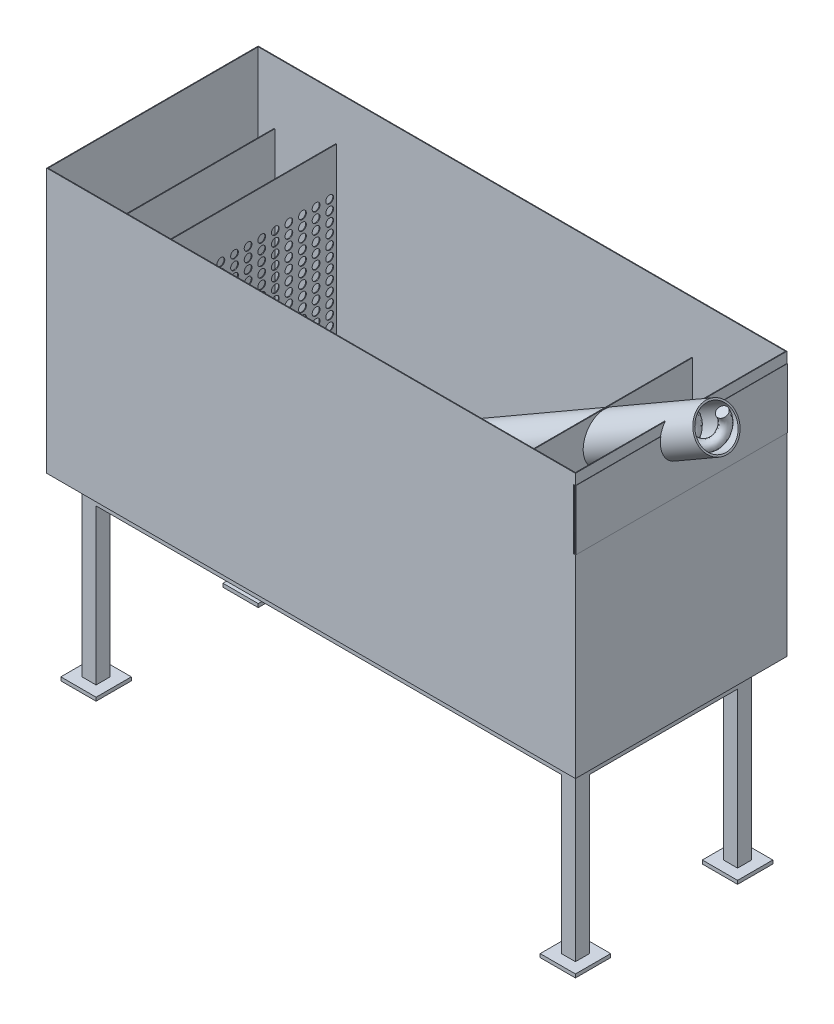
from build123d import *

# Parameters (mm, degrees)
MASTER_FOOTPRINT_W                       = 1500
MASTER_FOOTPRINT_H                       = 600
BATH_BASE_PLATE_DEPTH                    = 750
BATH_SHELL_2MM_T                         = -2
SKETCH_1_R                               = 50.00000000000001
INLET_D100_OPENING_DEPTH                 = 10
INLET_IMPACT_BAFFLE_START                = 125
SKETCH_2_W                               = 440
SKETCH_2_H                               = 430
INLET_IMPACT_BAFFLE_DEPTH                = 2
DISTRIBUTOR_D22_START                    = 250
SKETCH_3_W                               = 540
SKETCH_3_H                               = 648
SKETCH_3_R                               = 10.999999999999996
SKETCH_3_R_2                             = 11.00000000000001
SKETCH_3_R_3                             = 10.999999999999982
DISTRIBUTOR_D22_DEPTH                    = 2
OUTLET_SUBMERGED_BAFFLE_START            = 1280
SKETCH_4_W                               = 499.9999999999999
SKETCH_4_H                               = 330
OUTLET_SUBMERGED_BAFFLE_DEPTH            = 2
OVERFLOW_WEIR_Z550_START                 = 1440
SKETCH_5_W                               = 590
SKETCH_5_H                               = 548
OVERFLOW_WEIR_Z550_DEPTH                 = 2
OUTLET_WEIR_SLOT_W600_START              = 1495
SKETCH_6_W                               = 600
SKETCH_6_H                               = 170
OUTLET_WEIR_SLOT_W600_DEPTH              = 10
SLOPED_SEDIMENT_FLOOR_START              = 275
SLOPED_SEDIMENT_FLOOR_DEPTH              = 975
SKETCH_8_W                               = 39.99999999999999
SKETCH_8_H                               = 39.99999999999999
SKETCH_8_H_2                             = 39.99999999999994
SKETCH_8_W_2                             = 40
FRAME_LEGS_40X40_H500_DEPTH              = 500
FRAME_LONGITUDINAL_RAILS_START           = -20
SKETCH_9_W                               = 1400
SKETCH_9_H                               = 39.99999999999999
SKETCH_9_H_2                             = 39.99999999999983
FRAME_LONGITUDINAL_RAILS_DEPTH           = 40
FRAME_TRANSVERSE_RAILS_START             = -20
SKETCH_10_W                              = 39.99999999999999
SKETCH_10_H                              = 420.00000000000006
SKETCH_10_W_2                            = 40
FRAME_TRANSVERSE_RAILS_DEPTH             = 40
FRAME_FOOT_PADS_100X100_START            = -500
SKETCH_11_W                              = 100.00000000000001
SKETCH_11_H                              = 100.00000000000001
SKETCH_11_H_2                            = 99.99999999999994
SKETCH_11_W_2                            = 100
FRAME_FOOT_PADS_100X100_DEPTH            = 10
SCREW_PASSAGE_D120_PROFILE_R             = 60
SCREW_CASING_ID110_T5_PROFILE_R          = 60
SCREW_CASING_ID110_T5_PROFILE_R_2        = 55
SHAFTLESS_ROUND_COIL_D100_P100_PROFILE_R = 15
CFD_INLET_LID_D100_START                 = 1
SKETCH_12_R                              = 49.999999999999986
CFD_INLET_LID_D100_DEPTH                 = 2
CFD_OUTLET_LID_W600_START                = 1499
SKETCH_13_W                              = 600
SKETCH_13_H                              = 170
CFD_OUTLET_LID_W600_DEPTH                = 2


with BuildPart() as part:
    # MASTER_FOOTPRINT → BATH_BASE_PLATE (new body)
    with BuildSketch(Plane(origin=(0, 0, 0), x_dir=(1, 0, 0), z_dir=(0, 1, 0))):
        with Locations((750, 300)):
            Rectangle(MASTER_FOOTPRINT_W, MASTER_FOOTPRINT_H)
    extrude(amount=BATH_BASE_PLATE_DEPTH)

    # BATH_SHELL_2MM
    bath_shell_2mm_openings = [part.faces().sort_by_distance(p)[0] for p in [
        (750, 750, -300),
    ]]
    offset(amount=BATH_SHELL_2MM_T, openings=bath_shell_2mm_openings, kind=Kind.INTERSECTION)

    # Эскиз1 → INLET_D100_OPENING (cut)
    with BuildSketch(Plane(origin=(0, 0, 0), x_dir=(0, 0, -1), z_dir=(1, 0, 0))):
        with Locations((300, 420)):
            Circle(SKETCH_1_R)
    extrude(amount=INLET_D100_OPENING_DEPTH, mode=Mode.SUBTRACT)

    # Эскиз6 → OUTLET_WEIR_SLOT_W600 (cut)
    with BuildSketch(Plane(origin=(0, 0, 0), x_dir=(0, 0, -1), z_dir=(1, 0, 0)).offset(OUTLET_WEIR_SLOT_W600_START)):
        with Locations((300, 635)):
            Rectangle(SKETCH_6_W, SKETCH_6_H)
    extrude(amount=OUTLET_WEIR_SLOT_W600_DEPTH, mode=Mode.SUBTRACT)

    # Эскиз7 → SLOPED_SEDIMENT_FLOOR (add)
    with BuildSketch(Plane(origin=(0, 0, 0), x_dir=(0, 0, -1), z_dir=(1, 0, 0)).offset(SLOPED_SEDIMENT_FLOOR_START)):
        Polygon((2, -1), (2, 120), (229.99999999999997, -1), align=None)
        Polygon((598, -1), (598, 120), (370, -1), align=None)
    extrude(amount=SLOPED_SEDIMENT_FLOOR_DEPTH)

    # Эскиз8 → FRAME_LEGS_40X40_H500 (add)
    with BuildSketch(Plane(origin=(0, 0, 0), x_dir=(1, 0, 0), z_dir=(0, 1, 0))):
        with Locations((70, 70)):
            Rectangle(SKETCH_8_W, SKETCH_8_H)
        with Locations((70, 530)):
            Rectangle(SKETCH_8_W, SKETCH_8_H_2)
        with Locations((1430, 70)):
            Rectangle(SKETCH_8_W_2, SKETCH_8_H)
        with Locations((1430, 530)):
            Rectangle(SKETCH_8_W_2, SKETCH_8_H_2)
    extrude(amount=-FRAME_LEGS_40X40_H500_DEPTH)

    # Эскиз9 → FRAME_LONGITUDINAL_RAILS (add)
    with BuildSketch(Plane(origin=(0, 0, 0), x_dir=(1, 0, 0), z_dir=(0, 1, 0)).offset(FRAME_LONGITUDINAL_RAILS_START)):
        with Locations((750, 70)):
            Rectangle(SKETCH_9_W, SKETCH_9_H)
        with Locations((750, 530)):
            Rectangle(SKETCH_9_W, SKETCH_9_H_2)
    extrude(amount=-FRAME_LONGITUDINAL_RAILS_DEPTH)

    # Эскиз10 → FRAME_TRANSVERSE_RAILS (add)
    with BuildSketch(Plane(origin=(0, 0, 0), x_dir=(1, 0, 0), z_dir=(0, 1, 0)).offset(FRAME_TRANSVERSE_RAILS_START)):
        with Locations((70, 300)):
            Rectangle(SKETCH_10_W, SKETCH_10_H)
        with Locations((1430, 300)):
            Rectangle(SKETCH_10_W_2, SKETCH_10_H)
    extrude(amount=-FRAME_TRANSVERSE_RAILS_DEPTH)

    # Эскиз11 → FRAME_FOOT_PADS_100X100 (add)
    with BuildSketch(Plane(origin=(0, 0, 0), x_dir=(1, 0, 0), z_dir=(0, 1, 0)).offset(FRAME_FOOT_PADS_100X100_START)):
        with Locations((70, 70)):
            Rectangle(SKETCH_11_W, SKETCH_11_H)
        with Locations((70, 530)):
            Rectangle(SKETCH_11_W, SKETCH_11_H_2)
        with Locations((1430, 70)):
            Rectangle(SKETCH_11_W_2, SKETCH_11_H)
        with Locations((1430, 530)):
            Rectangle(SKETCH_11_W_2, SKETCH_11_H_2)
    extrude(amount=-FRAME_FOOT_PADS_100X100_DEPTH)


with BuildPart() as body_2:
    # Эскиз2 → INLET_IMPACT_BAFFLE (new body)
    with BuildSketch(Plane(origin=(0, 0, 0), x_dir=(0, 0, -1), z_dir=(1, 0, 0)).offset(INLET_IMPACT_BAFFLE_START)):
        with Locations((300, 435)):
            Rectangle(SKETCH_2_W, SKETCH_2_H)
    extrude(amount=INLET_IMPACT_BAFFLE_DEPTH)


with BuildPart() as body_3:
    # Эскиз3 → DISTRIBUTOR_D22 (new body)
    with BuildSketch(Plane(origin=(0, 0, 0), x_dir=(0, 0, -1), z_dir=(1, 0, 0)).offset(DISTRIBUTOR_D22_START)):
        with Locations((300, 326)):
            Rectangle(SKETCH_3_W, SKETCH_3_H)
        with Locations((49.28571428571428, 125)):
            Circle(SKETCH_3_R, mode=Mode.SUBTRACT)
        with Locations((49.28571428571428, 153.5)):
            Circle(SKETCH_3_R, mode=Mode.SUBTRACT)
        with Locations((49.28571428571428, 182)):
            Circle(SKETCH_3_R, mode=Mode.SUBTRACT)
        with Locations((49.28571428571428, 210.50000000000003)):
            Circle(SKETCH_3_R, mode=Mode.SUBTRACT)
        with Locations((49.28571428571428, 239)):
            Circle(SKETCH_3_R, mode=Mode.SUBTRACT)
        with Locations((49.28571428571428, 267.5)):
            Circle(SKETCH_3_R, mode=Mode.SUBTRACT)
        with Locations((49.28571428571428, 296.00000000000006)):
            Circle(SKETCH_3_R, mode=Mode.SUBTRACT)
        with Locations((49.28571428571428, 324.5)):
            Circle(SKETCH_3_R, mode=Mode.SUBTRACT)
        with Locations((49.28571428571428, 353)):
            Circle(SKETCH_3_R, mode=Mode.SUBTRACT)
        with Locations((49.28571428571428, 381.5)):
            Circle(SKETCH_3_R, mode=Mode.SUBTRACT)
        with Locations((49.28571428571428, 410.00000000000006)):
            Circle(SKETCH_3_R, mode=Mode.SUBTRACT)
        with Locations((49.28571428571428, 438.5)):
            Circle(SKETCH_3_R, mode=Mode.SUBTRACT)
        with Locations((49.28571428571428, 467)):
            Circle(SKETCH_3_R, mode=Mode.SUBTRACT)
        with Locations((49.28571428571428, 495.5)):
            Circle(SKETCH_3_R, mode=Mode.SUBTRACT)
        with Locations((49.28571428571428, 524)):
            Circle(SKETCH_3_R, mode=Mode.SUBTRACT)
        with Locations((87.85714285714285, 125)):
            Circle(SKETCH_3_R, mode=Mode.SUBTRACT)
        with Locations((87.85714285714285, 153.5)):
            Circle(SKETCH_3_R, mode=Mode.SUBTRACT)
        with Locations((87.85714285714285, 182)):
            Circle(SKETCH_3_R, mode=Mode.SUBTRACT)
        with Locations((87.85714285714285, 210.50000000000003)):
            Circle(SKETCH_3_R, mode=Mode.SUBTRACT)
        with Locations((87.85714285714285, 239)):
            Circle(SKETCH_3_R, mode=Mode.SUBTRACT)
        with Locations((87.85714285714285, 267.5)):
            Circle(SKETCH_3_R, mode=Mode.SUBTRACT)
        with Locations((87.85714285714285, 296.00000000000006)):
            Circle(SKETCH_3_R, mode=Mode.SUBTRACT)
        with Locations((87.85714285714285, 324.5)):
            Circle(SKETCH_3_R, mode=Mode.SUBTRACT)
        with Locations((87.85714285714285, 353)):
            Circle(SKETCH_3_R, mode=Mode.SUBTRACT)
        with Locations((87.85714285714285, 381.5)):
            Circle(SKETCH_3_R, mode=Mode.SUBTRACT)
        with Locations((87.85714285714285, 410.00000000000006)):
            Circle(SKETCH_3_R, mode=Mode.SUBTRACT)
        with Locations((87.85714285714285, 438.5)):
            Circle(SKETCH_3_R, mode=Mode.SUBTRACT)
        with Locations((87.85714285714285, 467)):
            Circle(SKETCH_3_R, mode=Mode.SUBTRACT)
        with Locations((87.85714285714285, 495.5)):
            Circle(SKETCH_3_R, mode=Mode.SUBTRACT)
        with Locations((87.85714285714285, 524)):
            Circle(SKETCH_3_R, mode=Mode.SUBTRACT)
        with Locations((126.42857142857142, 125)):
            Circle(SKETCH_3_R_2, mode=Mode.SUBTRACT)
        with Locations((126.42857142857142, 153.5)):
            Circle(SKETCH_3_R_2, mode=Mode.SUBTRACT)
        with Locations((126.42857142857142, 182)):
            Circle(SKETCH_3_R_2, mode=Mode.SUBTRACT)
        with Locations((126.42857142857142, 210.50000000000003)):
            Circle(SKETCH_3_R_2, mode=Mode.SUBTRACT)
        with Locations((126.42857142857142, 239)):
            Circle(SKETCH_3_R_2, mode=Mode.SUBTRACT)
        with Locations((126.42857142857142, 267.5)):
            Circle(SKETCH_3_R_2, mode=Mode.SUBTRACT)
        with Locations((126.42857142857142, 296.00000000000006)):
            Circle(SKETCH_3_R_2, mode=Mode.SUBTRACT)
        with Locations((126.42857142857142, 324.5)):
            Circle(SKETCH_3_R_2, mode=Mode.SUBTRACT)
        with Locations((126.42857142857142, 353)):
            Circle(SKETCH_3_R_2, mode=Mode.SUBTRACT)
        with Locations((126.42857142857142, 381.5)):
            Circle(SKETCH_3_R_2, mode=Mode.SUBTRACT)
        with Locations((126.42857142857142, 410.00000000000006)):
            Circle(SKETCH_3_R_2, mode=Mode.SUBTRACT)
        with Locations((126.42857142857142, 438.5)):
            Circle(SKETCH_3_R_2, mode=Mode.SUBTRACT)
        with Locations((126.42857142857142, 467)):
            Circle(SKETCH_3_R_2, mode=Mode.SUBTRACT)
        with Locations((126.42857142857142, 495.5)):
            Circle(SKETCH_3_R_2, mode=Mode.SUBTRACT)
        with Locations((126.42857142857142, 524)):
            Circle(SKETCH_3_R_2, mode=Mode.SUBTRACT)
        with Locations((164.99999999999997, 125)):
            Circle(SKETCH_3_R_2, mode=Mode.SUBTRACT)
        with Locations((164.99999999999997, 153.5)):
            Circle(SKETCH_3_R_2, mode=Mode.SUBTRACT)
        with Locations((164.99999999999997, 182)):
            Circle(SKETCH_3_R_2, mode=Mode.SUBTRACT)
        with Locations((164.99999999999997, 210.50000000000003)):
            Circle(SKETCH_3_R_2, mode=Mode.SUBTRACT)
        with Locations((164.99999999999997, 239)):
            Circle(SKETCH_3_R_2, mode=Mode.SUBTRACT)
        with Locations((164.99999999999997, 267.5)):
            Circle(SKETCH_3_R_2, mode=Mode.SUBTRACT)
        with Locations((164.99999999999997, 296.00000000000006)):
            Circle(SKETCH_3_R_2, mode=Mode.SUBTRACT)
        with Locations((164.99999999999997, 324.5)):
            Circle(SKETCH_3_R_2, mode=Mode.SUBTRACT)
        with Locations((164.99999999999997, 353)):
            Circle(SKETCH_3_R_2, mode=Mode.SUBTRACT)
        with Locations((164.99999999999997, 381.5)):
            Circle(SKETCH_3_R_2, mode=Mode.SUBTRACT)
        with Locations((164.99999999999997, 410.00000000000006)):
            Circle(SKETCH_3_R_2, mode=Mode.SUBTRACT)
        with Locations((164.99999999999997, 438.5)):
            Circle(SKETCH_3_R_2, mode=Mode.SUBTRACT)
        with Locations((164.99999999999997, 467)):
            Circle(SKETCH_3_R_2, mode=Mode.SUBTRACT)
        with Locations((164.99999999999997, 495.5)):
            Circle(SKETCH_3_R_2, mode=Mode.SUBTRACT)
        with Locations((164.99999999999997, 524)):
            Circle(SKETCH_3_R_2, mode=Mode.SUBTRACT)
        with Locations((203.57142857142856, 125)):
            Circle(SKETCH_3_R_2, mode=Mode.SUBTRACT)
        with Locations((203.57142857142856, 153.5)):
            Circle(SKETCH_3_R_2, mode=Mode.SUBTRACT)
        with Locations((203.57142857142856, 182)):
            Circle(SKETCH_3_R_2, mode=Mode.SUBTRACT)
        with Locations((203.57142857142856, 210.50000000000003)):
            Circle(SKETCH_3_R_2, mode=Mode.SUBTRACT)
        with Locations((203.57142857142856, 239)):
            Circle(SKETCH_3_R_2, mode=Mode.SUBTRACT)
        with Locations((203.57142857142856, 267.5)):
            Circle(SKETCH_3_R_2, mode=Mode.SUBTRACT)
        with Locations((203.57142857142856, 296.00000000000006)):
            Circle(SKETCH_3_R_2, mode=Mode.SUBTRACT)
        with Locations((203.57142857142856, 324.5)):
            Circle(SKETCH_3_R_2, mode=Mode.SUBTRACT)
        with Locations((203.57142857142856, 353)):
            Circle(SKETCH_3_R_2, mode=Mode.SUBTRACT)
        with Locations((203.57142857142856, 381.5)):
            Circle(SKETCH_3_R_2, mode=Mode.SUBTRACT)
        with Locations((203.57142857142856, 410.00000000000006)):
            Circle(SKETCH_3_R_2, mode=Mode.SUBTRACT)
        with Locations((203.57142857142856, 438.5)):
            Circle(SKETCH_3_R_2, mode=Mode.SUBTRACT)
        with Locations((203.57142857142856, 467)):
            Circle(SKETCH_3_R_2, mode=Mode.SUBTRACT)
        with Locations((203.57142857142856, 495.5)):
            Circle(SKETCH_3_R_2, mode=Mode.SUBTRACT)
        with Locations((203.57142857142856, 524)):
            Circle(SKETCH_3_R_2, mode=Mode.SUBTRACT)
        with Locations((242.14285714285714, 125)):
            Circle(SKETCH_3_R_3, mode=Mode.SUBTRACT)
        with Locations((242.14285714285714, 153.5)):
            Circle(SKETCH_3_R_3, mode=Mode.SUBTRACT)
        with Locations((242.14285714285714, 182)):
            Circle(SKETCH_3_R_3, mode=Mode.SUBTRACT)
        with Locations((242.14285714285714, 210.50000000000003)):
            Circle(SKETCH_3_R_3, mode=Mode.SUBTRACT)
        with Locations((242.14285714285714, 239)):
            Circle(SKETCH_3_R_3, mode=Mode.SUBTRACT)
        with Locations((242.14285714285714, 267.5)):
            Circle(SKETCH_3_R_3, mode=Mode.SUBTRACT)
        with Locations((242.14285714285714, 296.00000000000006)):
            Circle(SKETCH_3_R_3, mode=Mode.SUBTRACT)
        with Locations((242.14285714285714, 324.5)):
            Circle(SKETCH_3_R_3, mode=Mode.SUBTRACT)
        with Locations((242.14285714285714, 353)):
            Circle(SKETCH_3_R_3, mode=Mode.SUBTRACT)
        with Locations((242.14285714285714, 381.5)):
            Circle(SKETCH_3_R_3, mode=Mode.SUBTRACT)
        with Locations((242.14285714285714, 410.00000000000006)):
            Circle(SKETCH_3_R_3, mode=Mode.SUBTRACT)
        with Locations((242.14285714285714, 438.5)):
            Circle(SKETCH_3_R_3, mode=Mode.SUBTRACT)
        with Locations((242.14285714285714, 467)):
            Circle(SKETCH_3_R_3, mode=Mode.SUBTRACT)
        with Locations((242.14285714285714, 495.5)):
            Circle(SKETCH_3_R_3, mode=Mode.SUBTRACT)
        with Locations((242.14285714285714, 524)):
            Circle(SKETCH_3_R_3, mode=Mode.SUBTRACT)
        with Locations((280.71428571428567, 125)):
            Circle(SKETCH_3_R_2, mode=Mode.SUBTRACT)
        with Locations((280.71428571428567, 153.5)):
            Circle(SKETCH_3_R_2, mode=Mode.SUBTRACT)
        with Locations((280.71428571428567, 182)):
            Circle(SKETCH_3_R_2, mode=Mode.SUBTRACT)
        with Locations((280.71428571428567, 210.50000000000003)):
            Circle(SKETCH_3_R_2, mode=Mode.SUBTRACT)
        with Locations((280.71428571428567, 239)):
            Circle(SKETCH_3_R_2, mode=Mode.SUBTRACT)
        with Locations((280.71428571428567, 267.5)):
            Circle(SKETCH_3_R_2, mode=Mode.SUBTRACT)
        with Locations((280.71428571428567, 296.00000000000006)):
            Circle(SKETCH_3_R_2, mode=Mode.SUBTRACT)
        with Locations((280.71428571428567, 324.5)):
            Circle(SKETCH_3_R_2, mode=Mode.SUBTRACT)
        with Locations((280.71428571428567, 353)):
            Circle(SKETCH_3_R_2, mode=Mode.SUBTRACT)
        with Locations((280.71428571428567, 381.5)):
            Circle(SKETCH_3_R_2, mode=Mode.SUBTRACT)
        with Locations((280.71428571428567, 410.00000000000006)):
            Circle(SKETCH_3_R_2, mode=Mode.SUBTRACT)
        with Locations((280.71428571428567, 438.5)):
            Circle(SKETCH_3_R_2, mode=Mode.SUBTRACT)
        with Locations((280.71428571428567, 467)):
            Circle(SKETCH_3_R_2, mode=Mode.SUBTRACT)
        with Locations((280.71428571428567, 495.5)):
            Circle(SKETCH_3_R_2, mode=Mode.SUBTRACT)
        with Locations((280.71428571428567, 524)):
            Circle(SKETCH_3_R_2, mode=Mode.SUBTRACT)
        with Locations((319.2857142857143, 125)):
            Circle(SKETCH_3_R_2, mode=Mode.SUBTRACT)
        with Locations((319.2857142857143, 153.5)):
            Circle(SKETCH_3_R_2, mode=Mode.SUBTRACT)
        with Locations((319.2857142857143, 182)):
            Circle(SKETCH_3_R_2, mode=Mode.SUBTRACT)
        with Locations((319.2857142857143, 210.50000000000003)):
            Circle(SKETCH_3_R_2, mode=Mode.SUBTRACT)
        with Locations((319.2857142857143, 239)):
            Circle(SKETCH_3_R_2, mode=Mode.SUBTRACT)
        with Locations((319.2857142857143, 267.5)):
            Circle(SKETCH_3_R_2, mode=Mode.SUBTRACT)
        with Locations((319.2857142857143, 296.00000000000006)):
            Circle(SKETCH_3_R_2, mode=Mode.SUBTRACT)
        with Locations((319.2857142857143, 324.5)):
            Circle(SKETCH_3_R_2, mode=Mode.SUBTRACT)
        with Locations((319.2857142857143, 353)):
            Circle(SKETCH_3_R_2, mode=Mode.SUBTRACT)
        with Locations((319.2857142857143, 381.5)):
            Circle(SKETCH_3_R_2, mode=Mode.SUBTRACT)
        with Locations((319.2857142857143, 410.00000000000006)):
            Circle(SKETCH_3_R_2, mode=Mode.SUBTRACT)
        with Locations((319.2857142857143, 438.5)):
            Circle(SKETCH_3_R_2, mode=Mode.SUBTRACT)
        with Locations((319.2857142857143, 467)):
            Circle(SKETCH_3_R_2, mode=Mode.SUBTRACT)
        with Locations((319.2857142857143, 495.5)):
            Circle(SKETCH_3_R_2, mode=Mode.SUBTRACT)
        with Locations((319.2857142857143, 524)):
            Circle(SKETCH_3_R_2, mode=Mode.SUBTRACT)
        with Locations((357.8571428571428, 125)):
            Circle(SKETCH_3_R_2, mode=Mode.SUBTRACT)
        with Locations((357.8571428571428, 153.5)):
            Circle(SKETCH_3_R_2, mode=Mode.SUBTRACT)
        with Locations((357.8571428571428, 182)):
            Circle(SKETCH_3_R_2, mode=Mode.SUBTRACT)
        with Locations((357.8571428571428, 210.50000000000003)):
            Circle(SKETCH_3_R_2, mode=Mode.SUBTRACT)
        with Locations((357.8571428571428, 239)):
            Circle(SKETCH_3_R_2, mode=Mode.SUBTRACT)
        with Locations((357.8571428571428, 267.5)):
            Circle(SKETCH_3_R_2, mode=Mode.SUBTRACT)
        with Locations((357.8571428571428, 296.00000000000006)):
            Circle(SKETCH_3_R_2, mode=Mode.SUBTRACT)
        with Locations((357.8571428571428, 324.5)):
            Circle(SKETCH_3_R_2, mode=Mode.SUBTRACT)
        with Locations((357.8571428571428, 353)):
            Circle(SKETCH_3_R_2, mode=Mode.SUBTRACT)
        with Locations((357.8571428571428, 381.5)):
            Circle(SKETCH_3_R_2, mode=Mode.SUBTRACT)
        with Locations((357.8571428571428, 410.00000000000006)):
            Circle(SKETCH_3_R_2, mode=Mode.SUBTRACT)
        with Locations((357.8571428571428, 438.5)):
            Circle(SKETCH_3_R_2, mode=Mode.SUBTRACT)
        with Locations((357.8571428571428, 467)):
            Circle(SKETCH_3_R_2, mode=Mode.SUBTRACT)
        with Locations((357.8571428571428, 495.5)):
            Circle(SKETCH_3_R_2, mode=Mode.SUBTRACT)
        with Locations((357.8571428571428, 524)):
            Circle(SKETCH_3_R_2, mode=Mode.SUBTRACT)
        with Locations((396.42857142857133, 125)):
            Circle(SKETCH_3_R_2, mode=Mode.SUBTRACT)
        with Locations((396.42857142857133, 153.5)):
            Circle(SKETCH_3_R_2, mode=Mode.SUBTRACT)
        with Locations((396.42857142857133, 182)):
            Circle(SKETCH_3_R_2, mode=Mode.SUBTRACT)
        with Locations((396.42857142857133, 210.50000000000003)):
            Circle(SKETCH_3_R_2, mode=Mode.SUBTRACT)
        with Locations((396.42857142857133, 239)):
            Circle(SKETCH_3_R_2, mode=Mode.SUBTRACT)
        with Locations((396.42857142857133, 267.5)):
            Circle(SKETCH_3_R_2, mode=Mode.SUBTRACT)
        with Locations((396.42857142857133, 296.00000000000006)):
            Circle(SKETCH_3_R_2, mode=Mode.SUBTRACT)
        with Locations((396.42857142857133, 324.5)):
            Circle(SKETCH_3_R_2, mode=Mode.SUBTRACT)
        with Locations((396.42857142857133, 353)):
            Circle(SKETCH_3_R_2, mode=Mode.SUBTRACT)
        with Locations((396.42857142857133, 381.5)):
            Circle(SKETCH_3_R_2, mode=Mode.SUBTRACT)
        with Locations((396.42857142857133, 410.00000000000006)):
            Circle(SKETCH_3_R_2, mode=Mode.SUBTRACT)
        with Locations((396.42857142857133, 438.5)):
            Circle(SKETCH_3_R_2, mode=Mode.SUBTRACT)
        with Locations((396.42857142857133, 467)):
            Circle(SKETCH_3_R_2, mode=Mode.SUBTRACT)
        with Locations((396.42857142857133, 495.5)):
            Circle(SKETCH_3_R_2, mode=Mode.SUBTRACT)
        with Locations((396.42857142857133, 524)):
            Circle(SKETCH_3_R_2, mode=Mode.SUBTRACT)
        with Locations((434.99999999999994, 125)):
            Circle(SKETCH_3_R_2, mode=Mode.SUBTRACT)
        with Locations((434.99999999999994, 153.5)):
            Circle(SKETCH_3_R_2, mode=Mode.SUBTRACT)
        with Locations((434.99999999999994, 182)):
            Circle(SKETCH_3_R_2, mode=Mode.SUBTRACT)
        with Locations((434.99999999999994, 210.50000000000003)):
            Circle(SKETCH_3_R_2, mode=Mode.SUBTRACT)
        with Locations((434.99999999999994, 239)):
            Circle(SKETCH_3_R_2, mode=Mode.SUBTRACT)
        with Locations((434.99999999999994, 267.5)):
            Circle(SKETCH_3_R_2, mode=Mode.SUBTRACT)
        with Locations((434.99999999999994, 296.00000000000006)):
            Circle(SKETCH_3_R_2, mode=Mode.SUBTRACT)
        with Locations((434.99999999999994, 324.5)):
            Circle(SKETCH_3_R_2, mode=Mode.SUBTRACT)
        with Locations((434.99999999999994, 353)):
            Circle(SKETCH_3_R_2, mode=Mode.SUBTRACT)
        with Locations((434.99999999999994, 381.5)):
            Circle(SKETCH_3_R_2, mode=Mode.SUBTRACT)
        with Locations((434.99999999999994, 410.00000000000006)):
            Circle(SKETCH_3_R_2, mode=Mode.SUBTRACT)
        with Locations((434.99999999999994, 438.5)):
            Circle(SKETCH_3_R_2, mode=Mode.SUBTRACT)
        with Locations((434.99999999999994, 467)):
            Circle(SKETCH_3_R_2, mode=Mode.SUBTRACT)
        with Locations((434.99999999999994, 495.5)):
            Circle(SKETCH_3_R_2, mode=Mode.SUBTRACT)
        with Locations((434.99999999999994, 524)):
            Circle(SKETCH_3_R_2, mode=Mode.SUBTRACT)
        with Locations((473.57142857142856, 125)):
            Circle(SKETCH_3_R_2, mode=Mode.SUBTRACT)
        with Locations((473.57142857142856, 153.5)):
            Circle(SKETCH_3_R_2, mode=Mode.SUBTRACT)
        with Locations((473.57142857142856, 182)):
            Circle(SKETCH_3_R_2, mode=Mode.SUBTRACT)
        with Locations((473.57142857142856, 210.50000000000003)):
            Circle(SKETCH_3_R_2, mode=Mode.SUBTRACT)
        with Locations((473.57142857142856, 239)):
            Circle(SKETCH_3_R_2, mode=Mode.SUBTRACT)
        with Locations((473.57142857142856, 267.5)):
            Circle(SKETCH_3_R_2, mode=Mode.SUBTRACT)
        with Locations((473.57142857142856, 296.00000000000006)):
            Circle(SKETCH_3_R_2, mode=Mode.SUBTRACT)
        with Locations((473.57142857142856, 324.5)):
            Circle(SKETCH_3_R_2, mode=Mode.SUBTRACT)
        with Locations((473.57142857142856, 353)):
            Circle(SKETCH_3_R_2, mode=Mode.SUBTRACT)
        with Locations((473.57142857142856, 381.5)):
            Circle(SKETCH_3_R_2, mode=Mode.SUBTRACT)
        with Locations((473.57142857142856, 410.00000000000006)):
            Circle(SKETCH_3_R_2, mode=Mode.SUBTRACT)
        with Locations((473.57142857142856, 438.5)):
            Circle(SKETCH_3_R_2, mode=Mode.SUBTRACT)
        with Locations((473.57142857142856, 467)):
            Circle(SKETCH_3_R_2, mode=Mode.SUBTRACT)
        with Locations((473.57142857142856, 495.5)):
            Circle(SKETCH_3_R_2, mode=Mode.SUBTRACT)
        with Locations((473.57142857142856, 524)):
            Circle(SKETCH_3_R_2, mode=Mode.SUBTRACT)
        with Locations((512.1428571428571, 125)):
            Circle(SKETCH_3_R_2, mode=Mode.SUBTRACT)
        with Locations((512.1428571428571, 153.5)):
            Circle(SKETCH_3_R_2, mode=Mode.SUBTRACT)
        with Locations((512.1428571428571, 182)):
            Circle(SKETCH_3_R_2, mode=Mode.SUBTRACT)
        with Locations((512.1428571428571, 210.50000000000003)):
            Circle(SKETCH_3_R_2, mode=Mode.SUBTRACT)
        with Locations((512.1428571428571, 239)):
            Circle(SKETCH_3_R_2, mode=Mode.SUBTRACT)
        with Locations((512.1428571428571, 267.5)):
            Circle(SKETCH_3_R_2, mode=Mode.SUBTRACT)
        with Locations((512.1428571428571, 296.00000000000006)):
            Circle(SKETCH_3_R_2, mode=Mode.SUBTRACT)
        with Locations((512.1428571428571, 324.5)):
            Circle(SKETCH_3_R_2, mode=Mode.SUBTRACT)
        with Locations((512.1428571428571, 353)):
            Circle(SKETCH_3_R_2, mode=Mode.SUBTRACT)
        with Locations((512.1428571428571, 381.5)):
            Circle(SKETCH_3_R_2, mode=Mode.SUBTRACT)
        with Locations((512.1428571428571, 410.00000000000006)):
            Circle(SKETCH_3_R_2, mode=Mode.SUBTRACT)
        with Locations((512.1428571428571, 438.5)):
            Circle(SKETCH_3_R_2, mode=Mode.SUBTRACT)
        with Locations((512.1428571428571, 467)):
            Circle(SKETCH_3_R_2, mode=Mode.SUBTRACT)
        with Locations((512.1428571428571, 495.5)):
            Circle(SKETCH_3_R_2, mode=Mode.SUBTRACT)
        with Locations((512.1428571428571, 524)):
            Circle(SKETCH_3_R_2, mode=Mode.SUBTRACT)
        with Locations((550.7142857142857, 125)):
            Circle(SKETCH_3_R_2, mode=Mode.SUBTRACT)
        with Locations((550.7142857142857, 153.5)):
            Circle(SKETCH_3_R_2, mode=Mode.SUBTRACT)
        with Locations((550.7142857142857, 182)):
            Circle(SKETCH_3_R_2, mode=Mode.SUBTRACT)
        with Locations((550.7142857142857, 210.50000000000003)):
            Circle(SKETCH_3_R_2, mode=Mode.SUBTRACT)
        with Locations((550.7142857142857, 239)):
            Circle(SKETCH_3_R_2, mode=Mode.SUBTRACT)
        with Locations((550.7142857142857, 267.5)):
            Circle(SKETCH_3_R_2, mode=Mode.SUBTRACT)
        with Locations((550.7142857142857, 296.00000000000006)):
            Circle(SKETCH_3_R_2, mode=Mode.SUBTRACT)
        with Locations((550.7142857142857, 324.5)):
            Circle(SKETCH_3_R_2, mode=Mode.SUBTRACT)
        with Locations((550.7142857142857, 353)):
            Circle(SKETCH_3_R_2, mode=Mode.SUBTRACT)
        with Locations((550.7142857142857, 381.5)):
            Circle(SKETCH_3_R_2, mode=Mode.SUBTRACT)
        with Locations((550.7142857142857, 410.00000000000006)):
            Circle(SKETCH_3_R_2, mode=Mode.SUBTRACT)
        with Locations((550.7142857142857, 438.5)):
            Circle(SKETCH_3_R_2, mode=Mode.SUBTRACT)
        with Locations((550.7142857142857, 467)):
            Circle(SKETCH_3_R_2, mode=Mode.SUBTRACT)
        with Locations((550.7142857142857, 495.5)):
            Circle(SKETCH_3_R_2, mode=Mode.SUBTRACT)
        with Locations((550.7142857142857, 524)):
            Circle(SKETCH_3_R_2, mode=Mode.SUBTRACT)
    extrude(amount=DISTRIBUTOR_D22_DEPTH)


with BuildPart() as body_4:
    # Эскиз4 → OUTLET_SUBMERGED_BAFFLE (new body)
    with BuildSketch(Plane(origin=(0, 0, 0), x_dir=(0, 0, -1), z_dir=(1, 0, 0)).offset(OUTLET_SUBMERGED_BAFFLE_START)):
        with Locations((299.99999999999994, 485)):
            Rectangle(SKETCH_4_W, SKETCH_4_H)
    extrude(amount=OUTLET_SUBMERGED_BAFFLE_DEPTH)


with BuildPart() as body_5:
    # Эскиз5 → OVERFLOW_WEIR_Z550 (new body)
    with BuildSketch(Plane(origin=(0, 0, 0), x_dir=(0, 0, -1), z_dir=(1, 0, 0)).offset(OVERFLOW_WEIR_Z550_START)):
        with Locations((300, 276)):
            Rectangle(SKETCH_5_W, SKETCH_5_H)
    extrude(amount=OVERFLOW_WEIR_Z550_DEPTH)


with BuildPart() as screw_passage_d120_tool:
    # SCREW_PASSAGE_D120: sweep along a curve in space
    with BuildLine() as screw_passage_d120_path:
        Line((400, 70, -300), (1600, 762.820323027551, -300))
    # SCREW_PASSAGE_D120 profile (on start of the path) → SCREW_PASSAGE_D120 (sweep)
    with BuildSketch(Plane(origin=(400, 70, -300), x_dir=(-0.5000000000000001, 0.8660254037844387, 0), z_dir=(0.8660254037844387, 0.5000000000000001, 0))):
        Circle(SCREW_PASSAGE_D120_PROFILE_R)
    sweep(path=screw_passage_d120_path.line)


with BuildPart() as part_1:
    add(part.part)

    # SCREW_PASSAGE_D120: cut by screw_passage_d120_tool
    add(screw_passage_d120_tool.part, mode=Mode.SUBTRACT)


with BuildPart() as body_4_1:
    add(body_4.part)

    # SCREW_PASSAGE_D120: cut by screw_passage_d120_tool
    add(screw_passage_d120_tool.part, mode=Mode.SUBTRACT)


with BuildPart() as body_6:
    # SCREW_CASING_ID110_T5: sweep along a curve in space
    with BuildLine() as screw_casing_id110_t5_path:
        Line((400, 70, -300), (1600, 762.820323027551, -300))
    # SCREW_CASING_ID110_T5 profile (on start of the path) → SCREW_CASING_ID110_T5 (sweep)
    with BuildSketch(Plane(origin=(400, 70, -300), x_dir=(-0.5000000000000001, 0.8660254037844387, 0), z_dir=(0.8660254037844387, 0.5000000000000001, 0))):
        Circle(SCREW_CASING_ID110_T5_PROFILE_R)
        Circle(SCREW_CASING_ID110_T5_PROFILE_R_2, mode=Mode.SUBTRACT)
    sweep(path=screw_casing_id110_t5_path.line)


with BuildPart() as body_7:
    # SHAFTLESS_ROUND_COIL_D100_P100: sweep along a curve in space
    with BuildLine() as shaftless_round_coil_d100_p100_path:
        add(Edge.make_bspline(
            [(382.5, 100.31088913245537, -300), (384.564126832484, 100.89679960651334, -295.4252626190951), (388.6923804974521, 102.06862055462925, -286.2757878572854), (398.13442746402075, 98.19776454464007, -274.63543839458805), (409.3104600517273, 91.32355733924642, -266.8464038762299), (421.58617012040133, 82.54465286487766, -264.09135899256023), (433.85356596039986, 73.78014905700061, -266.78862540424325), (445.0881010529496, 66.80461254084834, -274.5286544424799), (454.4000360154246, 63.1591171326243, -286.13621233156675), (461.197456487716, 63.86888857776613, -299.8488258278908), (465.26866699277394, 69.30059419825714, -313.5843933715703), (466.8163390998659, 79.10319653887622, -325.25732809645314), (466.426200947709, 92.26218470394231, -333.09523004350996), (464.9782451375268, 107.25336679785208, -335.9080045692546), (463.5130734819898, 122.2743676106112, -333.2685644354147), (463.0739040042549, 135.5182805227412, -325.57767806015863), (464.54816759331237, 145.44803014630403, -314.003117474915), (468.5327626423438, 151.02975813735404, -300.302345664835), (475.2434227413281, 151.88980295714714, -286.55566616687736), (484.4819600829853, 148.37143595733454, -274.85035306876887), (495.6663579719135, 141.48273962520364, -266.96372261055393), (507.91914332354327, 132.7435419255055, -264.09326829583546), (520.2006207893836, 123.95464802621649, -266.6748353708781), (531.4667384557318, 116.92440888761196, -274.3164427712902), (540.8276150360007, 113.19414411076411, -285.85780090729605), (547.6826580387994, 113.80411040540636, -299.5464882011584), (551.8117567825574, 119.13555065530883, -313.30403600976126), (553.4087036535182, 128.85280660137536, -325.04152001826714), (553.0517689761136, 141.95428466118315, -332.9767392064443), (551.61589736088, 156.92453631547306, -335.9048224347294), (550.1398574976865, 171.9643614160809, -333.38117417370665), (549.6685171596843, 185.26399589271685, -325.7889811865904), (551.0941921320922, 195.27790346898624, -314.281030056743), (555.0211583937147, 200.95944744780704, -300.604669894888), (561.673899807404, 201.91981037323922, -286.83649761190105), (570.8630228451327, 198.48703145845056, -275.0670507260172), (582.0140138019443, 191.65619763007103, -267.08338345025123), (594.2544720488692, 182.9383511020314, -264.097723205211), (606.5465739655579, 174.13105511407133, -266.56340792353376), (617.8446544384698, 167.04545477054538, -274.1060519347144), (627.253978998992, 163.2312756303746, -285.58039209358253), (634.1665988909854, 163.7415158275906, -299.2441827261242), (638.3536610490263, 168.97256049897464, -313.0227354589283), (640.000156786148, 178.6039952913932, -324.82393662266566), (639.6768330052581, 191.64725757074916, -332.8559104849623), (638.2535308914903, 206.5957382098747, -335.89909482946143), (636.7671106014776, 221.65354273713788, -333.4914173551837), (636.2640160559722, 235.00817711452288, -325.99845600438135), (637.6413845488722, 245.10575396763522, -314.55793018559893), (641.510826838479, 250.88693238864008, -300.9069512568962), (648.1055611366372, 251.94776658537253, -287.11826228282376), (657.2450016240585, 248.6010403719662, -275.2855160035632), (668.3621783156997, 241.82877456888252, -267.20537791197194), (680.5898248871695, 233.1331185136615, -264.1047234048566), (692.8920630226701, 224.3082660797222, -266.45435096185395), (704.2216885412174, 217.16802811442864, -273.89749684840154), (713.6791772243276, 213.2704262668336, -285.3040055573114), (720.6492671516132, 213.6811254430106, -298.9419308347211), (724.8943790983257, 218.81162493104637, -312.7405116618611), (726.5906901893372, 228.356776999531, -324.60459333521385), (726.3013834429559, 241.34112004679574, -332.7327524452105), (724.8911349515606, 256.2669911487486, -335.8908221595088), (723.3948228303958, 271.3419288301475, -333.59928616416056), (722.860392960221, 284.75083758193153, -326.20608766282413), (724.1897405411053, 294.9315890944806, -314.8337982306609), (728.0017677507315, 300.8122133511328, -301.2091683206371), (734.538410615941, 301.9736648612168, -287.4009402039521), (743.6279038288086, 298.713449865037, -275.50573341332085), (754.7108613195153, 292.00045345656616, -267.3296973469242), (766.9252125530547, 283.32782560214406, -264.1142683984929), (779.2370979567269, 274.486263609578, -266.347672217427), (790.5978485235961, 267.29211547920306, -273.6907922978545), (800.1032140570355, 263.3115884943309, -285.0286608928936), (807.1306630913758, 263.6229387828122, -298.63975395508294), (811.4339070857119, 268.65275061081644, -312.457384626803), (813.1802964866847, 278.11116450209073, -324.3835057062438), (812.925410501169, 291.03588904270106, -332.6072738184727), (811.5286988276175, 305.9383136883758, -335.88000501136224), (810.0229841722486, 321.0295370367361, -333.70477295328305), (809.4576400817543, 334.4919907887895, -326.41186144188174), (810.7392557225559, 344.7554164467062, -315.1086146342763), (814.4939808146754, 350.7352908822605, -301.5112996604448), (820.9724520479086, 351.99749861448726, -287.6845113348483), (830.0117368029861, 348.8242472181694, -275.7276873429865), (841.0600725829635, 342.1712173717274, -267.4563329414875), (853.2606457586695, 333.5224538135015, -264.1263575094284), (865.5816887959296, 324.665030334284, -266.24337925323766), (876.9731422071981, 317.41770331747284, -273.48595293738316), (886.5260939244816, 313.3547546444449, -284.7543776208762), (893.6107870711676, 313.56695522190887, -298.3376735100261), (897.9722412508102, 318.49594405144467, -312.1733744260323), (899.768968367516, 327.86717046153177, -324.1606894097531), (899.5489044289652, 340.7315814475757, -332.4794835005502), (898.1662118090363, 355.6097243801021, -335.866644151903), (896.6515845830037, 370.7163847536779, -333.8078702440699), (896.0557495682019, 384.23165033580136, -326.6157627532315), (897.2899256248077, 394.5772437638356, -315.3823599133486), (900.9874656243259, 400.65616568521085, -301.8133238567323), (907.4076891506296, 402.01926140526336, -287.96895557174935), (916.396507824207, 398.93341982616283, -275.95136205714675), (927.409821838164, 392.34104945783844, -267.58527571783696), (939.5961352129292, 383.7169845993486, -264.1409898806059), (951.9258455999641, 374.8445488299541, -266.1414794631309), (963.347577475032, 367.54477797546673, -273.2829932890646), (972.9478213360536, 363.39991690668563, -284.4811751865597), (980.089639542058, 363.5131739790249, -298.0357109155295), (984.5093779178811, 368.3412116194976, -311.88850119443845), (986.3566985874025, 377.6248074255727, -323.9361602422928), (986.1718555132079, 390.428214085065, -332.3493905511316), (984.8036631888007, 405.2812417690236, -335.8507405283486), (983.2806139875005, 420.40248943166216, -333.9085707274435), (982.6547135060571, 433.96982992956356, -326.81777714129953), (983.8417456975797, 444.3970789271857, -315.6550146607195), (987.4822216835367, 450.57483861933343, -302.1152194975083), (993.844125557427, 452.0389469404455, -288.25425274899413), (1002.7822241035847, 449.0409551990032, -276.17674169839364), (1013.7601187790972, 442.5099329244342, -267.71651653458053), (1025.9316916207615, 433.9113994182065, -264.15816447466443), (1038.2695784592859, 425.0248016194053, -266.0419800712876), (1049.7211622709642, 417.6733256940053, -273.08192774171306), (1059.3684008828434, 413.44706732904916, -284.2090729586181), (1066.56722104526, 413.4615941167516, -297.7338875792175), (1071.0453134960828, 418.1885595344961, -311.60278512809674), (1072.9434799686742, 427.384087826303, -323.70993412184777), (1072.7942540792462, 440.12580371215705, -332.21700419315096), (1071.4410422642611, 454.95288439267284, -335.8322952681855), (1069.9100622801661, 470.087868574056, -334.0068672642477), (1069.254523921235, 483.70654338159477, -327.0178902842846), (1070.3947113090505, 494.21492995930737, -315.9265595465421), (1073.9782484060368, 500.49131070007934, -302.4169651798948), (1080.2817648165985, 502.0565490742017, -288.54038264045323), (1089.168892785218, 499.14684096274647, -276.4038102884464), (1100.1109730609141, 492.67785104830193, -267.8500460874069), (1112.267325682347, 484.10567973681765, -264.17788007401157), (1124.612897494408, 475.20577117339747, -265.94488813171245), (1136.0939045991545, 467.80333260947583, -272.8827705498627), (1145.787837237321, 463.49619781858127, -283.938090227726), (1153.0435322120927, 463.4122145416133, -297.43222489884187), (1157.580044479724, 468.0379938684761, -311.316246482835), (1159.5293054009296, 477.1450239792991, -323.48202708670846), (1159.4160904915987, 489.824367017994, -332.08233381213296), (1158.0783383378946, 504.62467077970376, -335.8113096790898), (1156.5399193257294, 519.7725397356634, -334.1027528857539), (1155.8551727796414, 533.4418046073549, -327.2160879951749), (1156.9488177461867, 544.0308050234153, -316.1969753196553), (1160.4755451154717, 550.4055830989288, -302.71853951164496), (1166.7206103911667, 552.0720618084014, -288.82732496095986), (1175.5565209456856, 549.2510648604001, -276.63255172928916), (1186.462394299255, 542.8447871746657, -267.98585490974364), (1198.6030480923614, 534.299807031461, -264.2001352809111), (1210.955812855179, 525.387439911874, -265.85021052773413), (1222.4658125234905, 517.9347847548167, -272.68553583275315), (1232.2061351530015, 513.5473001419506, -283.66824620519156), (1239.5185737639345, 513.3650340041455, -297.1307442607647), (1244.113567448514, 517.889520545555, -311.02890557279636), (1246.114167841538, 526.9076280827551, -323.252455294334), (1246.0373551546395, 539.5239206226885, -331.94538895552796), (1244.7155407180626, 554.2966194485773, -335.7877852488339), (1243.170174959941, 569.4565205214803, -334.19622079415547), (1242.45665198774, 583.1756276252601, -327.4123562227526), (1243.5040602150737, 593.844712422811, -316.4662428089445), (1246.9741110454518, 600.3176571433094, -303.0199211126615), (1253.160665658631, 602.085479293043, -289.1150593677523), (1261.9451155935442, 599.3536147527873, -276.8629498043072), (1272.8143920695627, 593.0107247183695, -268.12393337343116), (1284.9388695392183, 584.4937627892625, -264.22492851758096), (1297.298334720068, 575.5697902052107, -265.75795397151717), (1308.836894167014, 568.0676680605075, -272.49023757332975), (1318.623299464111, 563.6003659260323, -283.3995600215948), (1325.9923465121733, 563.3200510989824, -296.82946703844175), (1330.645879067803, 567.7431453415159, -310.7407827690021), (1332.698060316141, 576.6719122166136, -323.0212350202057), (1332.6580385132754, 589.2244810761468, -331.80617933203536), (1331.3526387197687, 603.9687489062503, -335.76172364518095), (1329.800818990294, 619.1398285854467, -334.28726436304936), (1329.0589533931275, 632.9080265556872, -327.60668105259083), (1330.06043384126, 643.6566606002933, -316.7343429247039), (1333.4739453396044, 650.2275343164998, -303.32108861650835), (1339.601933910731, 652.0967958266666, -289.4035654619127), (1348.334683668832, 649.454478619411, -277.0949881794395), (1359.16697590641, 643.1756471650508, -268.2642716894028), (1371.2748007043072, 634.6875285095102, -264.2522580263058), (1383.640473295441, 625.752804375465, -265.66812500358594), (1395.2071577113443, 618.2019683555632, -272.29688961725424), (1405.039335085242, 613.6553866585032, -283.1320507254309), (1412.4648513581494, 613.277264264958, -296.5284145909083), (1417.17697608882, 617.5988738833939, -310.4518984979056), (1419.2809759191457, 626.437888341714, -322.7883826566751), (1419.2781310536254, 638.9260648568948, -331.6647148109153), (1417.9896216654151, 653.6410776468629, -335.73312671576736), (1416.4318411967465, 668.8224816291957, -334.3758771379059), (1415.6620687851096, 682.6390156199751, -327.7990487080396), (1416.6179336700995, 693.4666581375608, -317.00125665998723), (1419.9750470516378, 700.1352162575263, -303.6220206719302), (1426.044418353212, 702.10600585676, -289.6928227898138), (1434.725232042574, 699.5536445593045, -277.32865040433654), (1445.520155302819, 693.339538072313, -268.40685990838017), (1457.6108522612412, 684.8810857049657, -264.2821218695614), (1469.9822388148345, 675.9364646976273, -265.58072999236083), (1481.5766113961042, 668.3376713685448, -272.10550567192104), (1491.454247011005, 663.7123536884432, -282.865737281758), (1498.93608929309, 663.2366717852151, -296.22760826126284), (1503.7068553489037, 667.4567116490806, -310.1622732399439), (1505.8629078142142, 676.2055682989379, -322.55391471179627), (1505.8976233036904, 688.6286883709151, -331.52100542129773), (1504.626478885579, 703.3136241504008, -335.7019964879349), (1503.0632313323906, 718.5044974008904, -334.46205283666126), (1502.2659898954848, 732.368609139069, -327.98944555069926), (1503.176554666363, 743.2747137558865, -317.26696509383737), (1506.4774151481765, 750.0407047562484, -303.92269593734994), (1512.4881220952584, 752.1131039980542, -289.9828108707427), (1521.1167675548757, 749.6511007250585, -277.5639198158541), (1531.873939565617, 743.5023813202556, -268.551688286093), (1543.9470354124048, 735.07441497253, -264.3145165697635), (1556.3236395329802, 726.1207568740865, -265.4957802107461), (1567.9452710020473, 718.4747497663807, -271.9160803577199), (1577.8680123860509, 713.7713066024796, -282.6007092848836), (1585.4061656328224, 713.1980912473907, -295.9268054668163), (1590.2351247622241, 717.3173377511517, -309.872912447421), (1592.4453010379677, 725.9724492114417, -322.31417203916646), (1592.5110876306626, 738.3417525539959, -331.3887795081075), (1591.2834207299968, 752.9513830642798, -335.6171383110405), (1589.6195132866026, 768.3166043588892, -334.7368546237161), (1589.3080715883448, 777.1782032462407, -329.88880343772087), (1589.1523507392155, 781.6090026899166, -327.46477784472336)],
            knots=[0, 0, 0, 0, 0.00450450450450451, 0.00900900900900902, 0.01351351351351353, 0.01801801801801804, 0.02252252252252253, 0.02702702702702705, 0.03153153153153156, 0.03603603603603606, 0.04054054054054058, 0.04504504504504508, 0.0495495495495496, 0.0540540540540541, 0.05855855855855861, 0.06306306306306311, 0.06756756756756763, 0.07207207207207213, 0.07657657657657665, 0.08108108108108114, 0.08558558558558564, 0.09009009009009016, 0.0945945945945947, 0.09909909909909921, 0.10360360360360373, 0.10810810810810821, 0.11261261261261271, 0.11711711711711723, 0.12162162162162174, 0.12612612612612625, 0.13063063063063077, 0.13513513513513525, 0.13963963963963977, 0.14414414414414428, 0.14864864864864877, 0.15315315315315328, 0.1576576576576578, 0.1621621621621623, 0.16666666666666685, 0.17117117117117137, 0.17567567567567588, 0.1801801801801804, 0.18468468468468488, 0.18918918918918942, 0.1936936936936939, 0.19819819819819848, 0.202702702702703, 0.20720720720720753, 0.21171171171171205, 0.2162162162162165, 0.22072072072072105, 0.2252252252252255, 0.22972972972973002, 0.2342342342342346, 0.23873873873873908, 0.2432432432432436, 0.24774774774774808, 0.2522522522522526, 0.2567567567567571, 0.2612612612612616, 0.2657657657657661, 0.2702702702702707, 0.27477477477477513, 0.2792792792792796, 0.28378378378378416, 0.2882882882882887, 0.2927927927927932, 0.2972972972972977, 0.3018018018018022, 0.30630630630630673, 0.3108108108108112, 0.3153153153153157, 0.31981981981982016, 0.32432432432432473, 0.3288288288288292, 0.3333333333333337, 0.3378378378378382, 0.34234234234234273, 0.3468468468468472, 0.3513513513513517, 0.3558558558558562, 0.36036036036036073, 0.3648648648648652, 0.3693693693693697, 0.3738738738738743, 0.3783783783783788, 0.3828828828828833, 0.3873873873873877, 0.3918918918918923, 0.39639639639639684, 0.40090090090090125, 0.4054054054054058, 0.40990990990991033, 0.41441441441441484, 0.41891891891891925, 0.4234234234234238, 0.4279279279279283, 0.43243243243243285, 0.43693693693693736, 0.4414414414414418, 0.4459459459459463, 0.45045045045045085, 0.4549549549549554, 0.4594594594594598, 0.4639639639639643, 0.46846846846846885, 0.47297297297297325, 0.47747747747747776, 0.4819819819819822, 0.48648648648648685, 0.49099099099099125, 0.49549549549549576, 0.5000000000000002, 0.5045045045045048, 0.5090090090090093, 0.5135135135135138, 0.5180180180180184, 0.5225225225225228, 0.5270270270270273, 0.5315315315315319, 0.5360360360360363, 0.5405405405405408, 0.5450450450450453, 0.5495495495495497, 0.5540540540540543, 0.5585585585585587, 0.5630630630630632, 0.5675675675675677, 0.5720720720720722, 0.5765765765765767, 0.5810810810810813, 0.5855855855855857, 0.5900900900900903, 0.5945945945945946, 0.5990990990990992, 0.6036036036036038, 0.6081081081081082, 0.6126126126126128, 0.6171171171171171, 0.6216216216216217, 0.6261261261261263, 0.6306306306306309, 0.6351351351351353, 0.6396396396396399, 0.6441441441441444, 0.6486486486486489, 0.6531531531531535, 0.6576576576576579, 0.6621621621621626, 0.6666666666666671, 0.6711711711711716, 0.675675675675676, 0.6801801801801806, 0.684684684684685, 0.6891891891891896, 0.693693693693694, 0.6981981981981986, 0.7027027027027032, 0.7072072072072078, 0.7117117117117121, 0.7162162162162166, 0.7207207207207211, 0.7252252252252257, 0.72972972972973, 0.7342342342342346, 0.7387387387387392, 0.7432432432432438, 0.7477477477477481, 0.7522522522522526, 0.7567567567567571, 0.7612612612612616, 0.7657657657657662, 0.7702702702702704, 0.774774774774775, 0.7792792792792795, 0.783783783783784, 0.7882882882882885, 0.7927927927927931, 0.7972972972972975, 0.801801801801802, 0.8063063063063066, 0.810810810810811, 0.8153153153153154, 0.81981981981982, 0.8243243243243245, 0.828828828828829, 0.8333333333333336, 0.8378378378378378, 0.8423423423423424, 0.846846846846847, 0.8513513513513513, 0.8558558558558559, 0.8603603603603603, 0.8648648648648649, 0.8693693693693696, 0.873873873873874, 0.8783783783783784, 0.882882882882883, 0.8873873873873873, 0.8918918918918919, 0.8963963963963963, 0.9009009009009009, 0.9054054054054056, 0.9099099099099102, 0.9144144144144144, 0.918918918918919, 0.9234234234234235, 0.9279279279279279, 0.9324324324324323, 0.936936936936937, 0.9414414414414415, 0.945945945945946, 0.9504504504504504, 0.9549549549549551, 0.9594594594594597, 0.963963963963964, 0.9684684684684686, 0.9729729729729732, 0.9774774774774777, 0.9819819819819822, 0.9864864864864867, 0.9909909909909911, 0.9954954954954957, 1, 1, 1, 1], degree=3))
    # SHAFTLESS_ROUND_COIL_D100_P100 profile (on start of the path) → SHAFTLESS_ROUND_COIL_D100_P100 (sweep)
    with BuildSketch(Plane(origin=(382.5, 100.31088913245537, -300), x_dir=(0.9115113261654293, 0, -0.41127497160919063), z_dir=(0.40850072571325174, 0.11595452861181108, 0.9053627474035805))):
        Circle(SHAFTLESS_ROUND_COIL_D100_P100_PROFILE_R)
    sweep(path=shaftless_round_coil_d100_p100_path.line, is_frenet=True)


with BuildPart() as body_8:
    # Эскиз12 → CFD_INLET_LID_D100 (new body)
    with BuildSketch(Plane(origin=(0, 0, 0), x_dir=(0, 0, -1), z_dir=(1, 0, 0)).offset(CFD_INLET_LID_D100_START)):
        with Locations((300, 420)):
            Circle(SKETCH_12_R)
    extrude(amount=CFD_INLET_LID_D100_DEPTH)


with BuildPart() as body_9:
    # Эскиз13 → CFD_OUTLET_LID_W600 (new body)
    with BuildSketch(Plane(origin=(0, 0, 0), x_dir=(0, 0, -1), z_dir=(1, 0, 0)).offset(CFD_OUTLET_LID_W600_START)):
        with Locations((300, 635)):
            Rectangle(SKETCH_13_W, SKETCH_13_H)
    extrude(amount=CFD_OUTLET_LID_W600_DEPTH)


solid = Compound([body_2.part, body_3.part, body_5.part, part_1.part, body_4_1.part, body_6.part, body_7.part, body_8.part, body_9.part])
